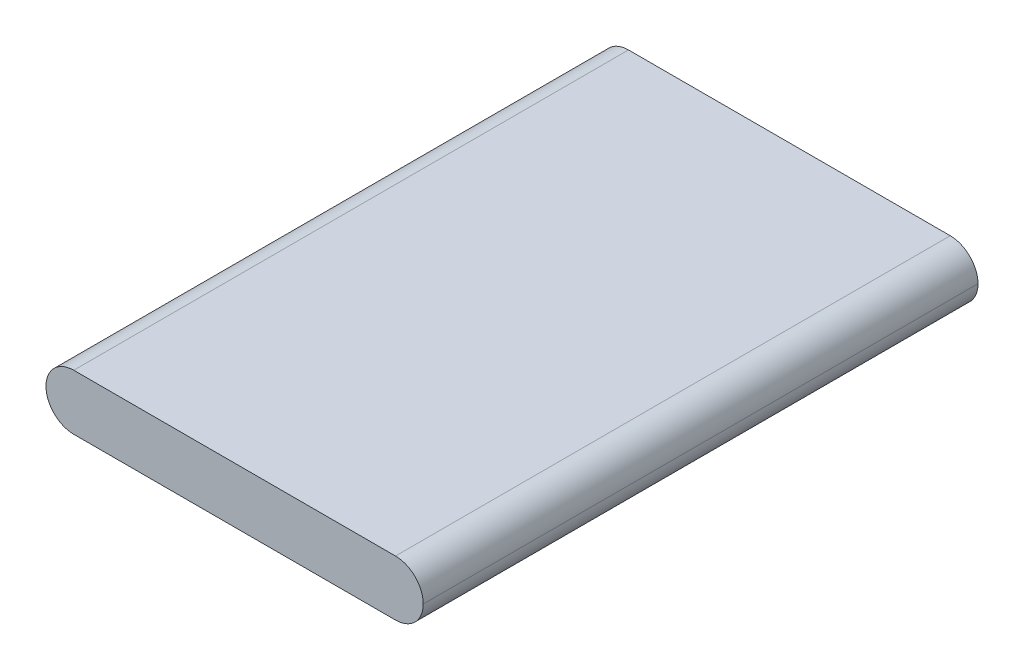
from build123d import *

# Parameters (mm, degrees)
SKETCH1_W           = 34
SKETCH1_H           = 50
BOSS_EXTRUDE1_DEPTH = 5
FILLET1_R           = 2.5


with BuildPart() as part:
    # Sketch1 → Boss-Extrude1 (new body)
    with BuildSketch(Plane(origin=(0, 0, 0), x_dir=(1, 0, 0), z_dir=(0, 1, 0))):
        Rectangle(SKETCH1_W, SKETCH1_H)
    extrude(amount=BOSS_EXTRUDE1_DEPTH)

    # Fillet1
    fillet1_edges = [part.edges().sort_by_distance(p)[0] for p in [
        (-17, 5, 0),
        (-17, 0, 0),
        (17, 0, 0),
        (17, 5, 0),
    ]]
    fillet(fillet1_edges, radius=FILLET1_R - 0.0001)  # a hair under: the kernel refuses the full size


solid = part.part
